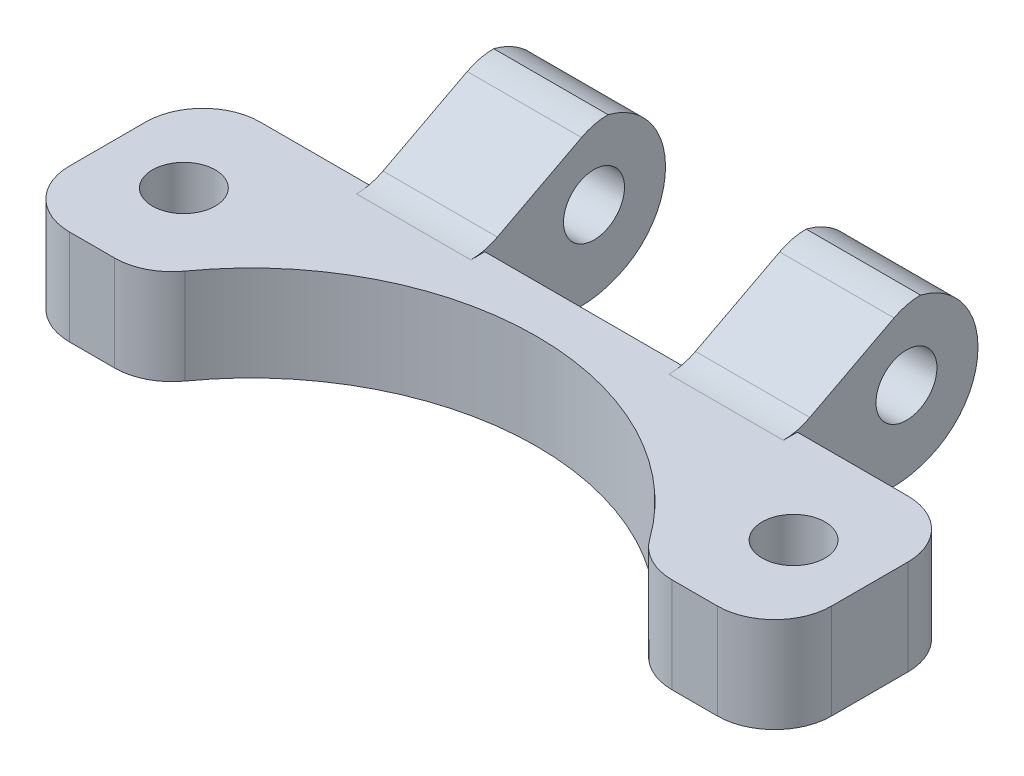
from build123d import *

# Parameters (mm, degrees)
ESQUISSE1_W                    = 40
ESQUISSE1_H                    = 10
BOSS_EXTRU_1_DEPTH             = 5
ESQUISSE2_R                    = 1.65
ENL_V_MAT_EXTRU_1_DEPTH        = 5
BOSS_EXTRU_2_REACH             = 41.929
ESQUISSE3_W                    = 6
ESQUISSE3_H                    = 10
BOSS_EXTRU_2_DIRECTION_2_DEPTH = 5
ESQUISSE4_R                    = 1.6
ENL_V_MAT_EXTRU_2_DEPTH        = 38.217801601
CONG_1_R                       = 5
ENL_V_MAT_EXTRU_3_DEPTH        = 38.217801601
CONG_3_R                       = 3
CONG_4_R                       = 3
CONG_5_R                       = 3
ENL_V_MAT_EXTRU_4_REACH        = 44.982
CONG_6_R                       = 3
CONG_7_START                   = -30.067545716
CONG_7_DEPTH                   = 22.4


with BuildPart() as part:
    # Esquisse1 → Boss.-Extru.1 (new body)
    with BuildSketch(Plane(origin=(0, 0, 0), x_dir=(1, 0, 0), z_dir=(0, 1, 0))):
        with Locations((-18.867545716, 2.655728702)):
            Rectangle(ESQUISSE1_W, ESQUISSE1_H)
    extrude(amount=BOSS_EXTRU_1_DEPTH)

    # Esquisse2 → Enlèv. mat.-Extru.1 (cut)
    with BuildSketch(Plane(origin=(0, 5, 0), x_dir=(1, 0, 0), z_dir=(0, 1, 0))):
        with Locations(Location((-34.867545716, 2.655728702, 0), (0, 0, 270))):
            Circle(ESQUISSE2_R)
        with Locations(Location((-2.867545716, 2.655728702, 0), (0, 0, 270))):
            Circle(ESQUISSE2_R)
    extrude(amount=-ENL_V_MAT_EXTRU_1_DEPTH, mode=Mode.SUBTRACT)

    # Boss.-Extru.2: up to this face of the body (flat: up to its plane)
    boss_extru_2_end = Plane(part.part.faces().sort_by_distance((-18.867545716, 0, -2.655728702))[0])
    # Esquisse3 → Boss.-Extru.2 (add, up to the picked face)
    with BuildSketch(Plane(origin=(0, 5, 0), x_dir=(1, 0, 0), z_dir=(0, 1, 0)), mode=Mode.PRIVATE) as boss_extru_2_sk1:
        with Locations((-10.667545716, 12.655728702)):
            Rectangle(ESQUISSE3_W, ESQUISSE3_H)
    boss_extru_2_tool1 = split(extrude(boss_extru_2_sk1.sketch, amount=-BOSS_EXTRU_2_REACH, mode=Mode.PRIVATE), bisect_by=boss_extru_2_end, keep=Keep.BOTH, mode=Mode.PRIVATE)
    # Esquisse3 → Boss.-Extru.2 (add, up to the picked face)
    with BuildSketch(Plane(origin=(0, 5, 0), x_dir=(1, 0, 0), z_dir=(0, 1, 0)), mode=Mode.PRIVATE) as boss_extru_2_sk2:
        with Locations((-27.067545716, 12.655728702)):
            Rectangle(ESQUISSE3_W, ESQUISSE3_H)
    boss_extru_2_tool2 = split(extrude(boss_extru_2_sk2.sketch, amount=-BOSS_EXTRU_2_REACH, mode=Mode.PRIVATE), bisect_by=boss_extru_2_end, keep=Keep.BOTH, mode=Mode.PRIVATE)
    add(boss_extru_2_tool1.solids().sort_by(Axis((-10.667546, 5, -12.655729), (0, -1, 0)))[0])
    add(boss_extru_2_tool2.solids().sort_by(Axis((-27.067546, 5, -12.655729), (0, -1, 0)))[0])

    # Esquisse3 → Boss.-Extru.2 direction 2 (add)
    with BuildSketch(Plane(origin=(0, 5, 0), x_dir=(1, 0, 0), z_dir=(0, 1, 0))):
        with Locations((-10.667545716, 12.655728702)):
            Rectangle(ESQUISSE3_W, ESQUISSE3_H)
        with Locations((-27.067545716, 12.655728702)):
            Rectangle(ESQUISSE3_W, ESQUISSE3_H)
    extrude(amount=BOSS_EXTRU_2_DIRECTION_2_DEPTH)

    # Esquisse4 → Enlèv. mat.-Extru.2 (cut, through all)
    with BuildSketch(Plane(origin=(-7.667545716, 0, 0), x_dir=(0, 0, -1), z_dir=(1, 0, 0))):
        with Locations((13.380728702, 4.275)):
            Circle(ESQUISSE4_R)
    extrude(amount=-ENL_V_MAT_EXTRU_2_DEPTH, mode=Mode.SUBTRACT)

    # Congé1
    cong_1_edges = [part.edges().sort_by_distance(p)[0] for p in [
        (-27.067545716, 0, -17.655728702),
        (-10.667545716, 0, -17.655728702),
    ]]
    fillet(cong_1_edges, radius=CONG_1_R)

    # Esquisse5 → Enlèv. mat.-Extru.3 (cut, through all)
    with BuildSketch(Plane(origin=(-7.667545716, 0, 0), x_dir=(0, 0, -1), z_dir=(1, 0, 0))):
        Polygon((7.655728702, 5), (13.380728702, 8), (17.655728702, 8), (17.655728702, 10), (7.655728702, 10), align=None)
    extrude(amount=-ENL_V_MAT_EXTRU_3_DEPTH, mode=Mode.SUBTRACT)

    # Congé3
    cong_3_edges = [part.edges().sort_by_distance(p)[0] for p in [
        (-10.667545716, 8, -13.380728702),
        (-27.067545716, 8, -13.380728702),
    ]]
    fillet(cong_3_edges, radius=CONG_3_R)

    # Congé4
    cong_4_edges = [part.edges().sort_by_distance(p)[0] for p in [
        (-10.667545716, 5, -7.655728702),
        (-27.067545716, 5, -7.655728702),
    ]]
    fillet(cong_4_edges, radius=CONG_4_R)

    # Congé5
    cong_5_edges = [part.edges().sort_by_distance(p)[0] for p in [
        (-38.867545716, 2.5, -7.655728702),
        (-38.867545716, 2.5, 2.344271298),
        (1.132454284, 2.5, 2.344271298),
        (1.132454284, 2.5, -7.655728702),
    ]]
    fillet(cong_5_edges, radius=CONG_5_R)

    # Esquisse6 → Enlèv. mat.-Extru.4 (cut, up to next)
    with BuildSketch(Plane(origin=(0, 5, 0), x_dir=(1, 0, 0), z_dir=(0, 1, 0)), mode=Mode.PRIVATE) as enl_v_mat_extru_4_sk1:
        with BuildLine():
            Line((-31.867545716, -2.344271298), (-5.867545716, -2.344271298))
            ThreePointArc((-5.867545716, -2.344271298), (-18.867545716, 5.172413928), (-31.867545716, -2.344271298))
        make_face()
    enl_v_mat_extru_4_tool1 = extrude(enl_v_mat_extru_4_sk1.sketch, amount=-ENL_V_MAT_EXTRU_4_REACH, mode=Mode.PRIVATE) & part.part
    add(enl_v_mat_extru_4_tool1.solids().sort_by_distance((-18.867546, 5, -0.73807))[0], mode=Mode.SUBTRACT)

    # Congé6
    cong_6_edges = [part.edges().sort_by_distance(p)[0] for p in [
        (-31.867545716, 2.5, 2.344271298),
        (-5.867545716, 2.5, 2.344271298),
    ]]
    fillet(cong_6_edges, radius=CONG_6_R)

    # Congé7: read off the stored shape, not the designer's step
    # Congé7 outline → Congé7 (cut)
    with BuildSketch(Plane.YZ.offset(CONG_7_START)):
        with BuildLine():
            Line((8, -17.655728702), (8, -14.119135311))
            ThreePointArc((8, -14.119135311), (4.626068057, -17.103985452), (0.613789507, -15.055969837))
            ThreePointArc((0.613789507, -15.055969837), (2.450608472, -16.956961414), (5, -17.655728702))
            Line((5, -17.655728702), (8, -17.655728702))
        make_face()
    extrude(amount=CONG_7_DEPTH, mode=Mode.SUBTRACT)


solid = part.part
